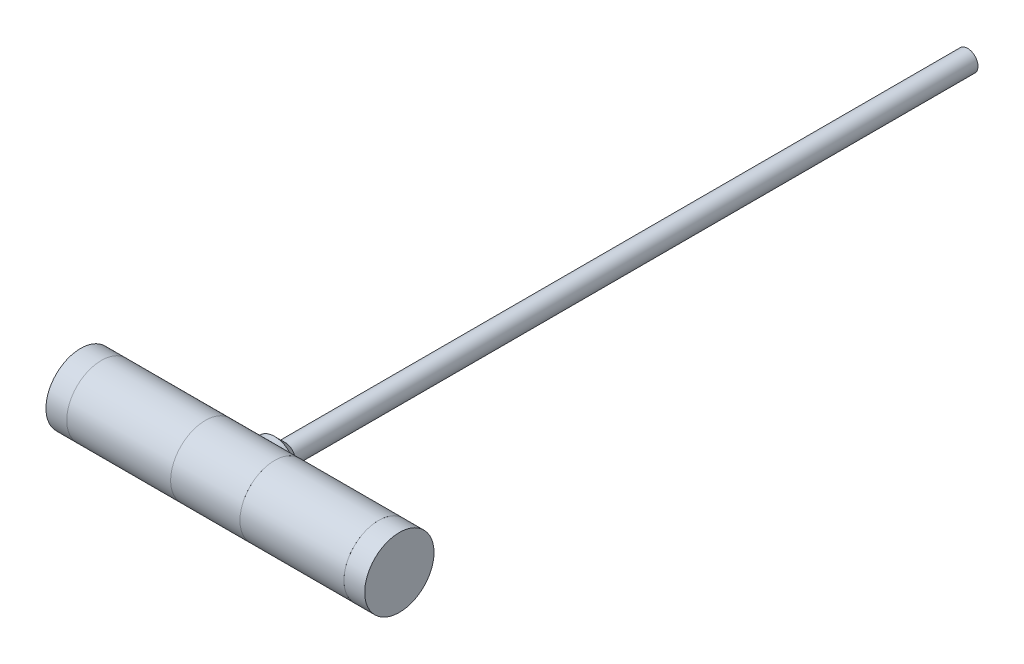
from build123d import *

# Parameters (mm, degrees)
OUTER_START                = 20
CONNECTOR_PIN_SKETCH_R     = 5
OUTER_PIN_EXTRUDE_1_DEPTH  = 3
OUTER_START_2              = -20
CONNECTOR_PIN_SKETCH_2_R   = 5
OUTER_PIN_EXTRUDE_2_DEPTH  = 3
MIDDLE_START               = 5
CONNECTOR_PIN_SKETCH_3_R   = 5
MIDDLE_PIN_EXTRUDE_1_DEPTH = 15
MIDDLE_START_2             = -5
CONNECTOR_PIN_SKETCH_4_R   = 5
MIDDLE_PIN_EXTRUDE_2_DEPTH = 15
CENTER_START               = -5
CONNECTOR_PIN_SKETCH_5_R   = 5
CENTER_PIN_EXTRUDE_DEPTH   = 10
T_JOINT_SKETCH_R           = 3
T_JOINT_EXTRUDE_DEPTH      = 5
PLUNGER_SKETCH_R           = 1.5
PLUNGER_EXTRUDE_DEPTH      = 100
PLUNGER_CHAMFER_SIZE       = 1.5


with BuildPart() as part:
    # Connector Pin Sketch → Outer Pin Extrude 1 (new body)
    with BuildSketch(Plane(origin=(0, 0, 0), x_dir=(0, 0, -1), z_dir=(1, 0, 0)).offset(OUTER_START)):
        Circle(CONNECTOR_PIN_SKETCH_R)
    extrude(amount=OUTER_PIN_EXTRUDE_1_DEPTH)


with BuildPart() as body_2:
    # Connector Pin Sketch<2> → Outer Pin Extrude 2 (new body)
    with BuildSketch(Plane(origin=(0, 0, 0), x_dir=(0, 0, -1), z_dir=(1, 0, 0)).offset(OUTER_START_2)):
        Circle(CONNECTOR_PIN_SKETCH_2_R)
    extrude(amount=-OUTER_PIN_EXTRUDE_2_DEPTH)


with BuildPart() as body_3:
    # Connector Pin Sketch<3> → Middle Pin Extrude 1 (new body)
    with BuildSketch(Plane(origin=(0, 0, 0), x_dir=(0, 0, -1), z_dir=(1, 0, 0)).offset(MIDDLE_START)):
        with Locations(Location((0, 0, 0), (0, 0, 180))):
            Circle(CONNECTOR_PIN_SKETCH_3_R)
    extrude(amount=MIDDLE_PIN_EXTRUDE_1_DEPTH)


with BuildPart() as body_4:
    # Connector Pin Sketch<4> → Middle Pin Extrude 2 (new body)
    with BuildSketch(Plane(origin=(0, 0, 0), x_dir=(0, 0, -1), z_dir=(1, 0, 0)).offset(MIDDLE_START_2)):
        Circle(CONNECTOR_PIN_SKETCH_4_R)
    extrude(amount=-MIDDLE_PIN_EXTRUDE_2_DEPTH)


with BuildPart() as body_5:
    # Connector Pin Sketch<5> → Center Pin Extrude (new body)
    with BuildSketch(Plane(origin=(0, 0, 0), x_dir=(0, 0, -1), z_dir=(1, 0, 0)).offset(CENTER_START)):
        Circle(CONNECTOR_PIN_SKETCH_5_R)
    extrude(amount=CENTER_PIN_EXTRUDE_DEPTH)

    # T Joint Sketch → T Joint Extrude (add)
    with BuildSketch(Plane.XY):
        Circle(T_JOINT_SKETCH_R)
    extrude(amount=-T_JOINT_EXTRUDE_DEPTH)

    # Plunger Sketch → Plunger Extrude (add)
    with BuildSketch(Plane(origin=(0, 0, -5), x_dir=(-1, 0, 0), z_dir=(0, 0, -1))):
        with Locations(Location((0, 0, 0), (0, 0, 180))):
            Circle(PLUNGER_SKETCH_R)
    extrude(amount=PLUNGER_EXTRUDE_DEPTH)

    # Plunger Chamfer
    plunger_chamfer_edges = [body_5.edges().sort_by_distance(p)[0] for p in [
        (-1.5, 0, -5),
    ]]
    chamfer(plunger_chamfer_edges, length=PLUNGER_CHAMFER_SIZE - 0.0001)  # a hair under: the kernel refuses the full size


solid = Compound([part.part, body_2.part, body_3.part, body_4.part, body_5.part])
